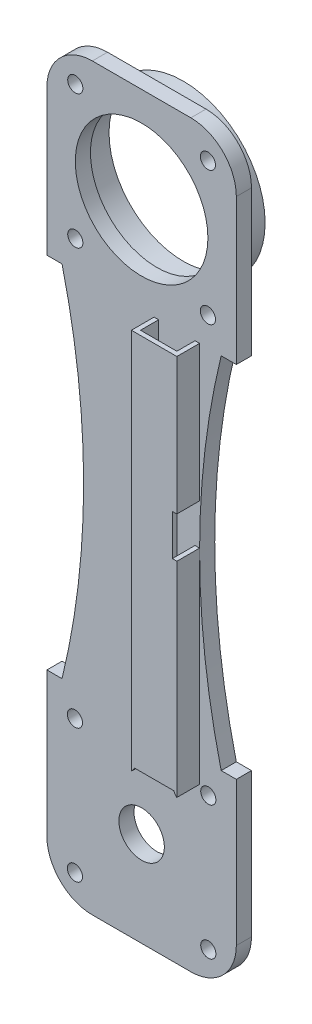
from build123d import *

# Parameters (mm, degrees)
SKETCH1_R           = 11.1125
SKETCH1_R_2         = 1.27
BOSS_EXTRUDE1_DEPTH = 2.54
SKETCH2_R           = 1.27
SKETCH2_R_2         = 3.81
CUT_EXTRUDE1_DEPTH  = 2.54
SKETCH3_R           = 13.716
SKETCH3_R_2         = 12.446
BOSS_EXTRUDE2_DEPTH = 4.445
SKETCH4_W           = 7.62
SKETCH4_H           = 64.008
SKETCH4_W_2         = 6.096
SKETCH4_H_2         = 62.484
EXTRUDE_THIN1_DEPTH = 3.81
SKETCH5_W           = 6.096
SKETCH5_H           = 3.81
CUT_EXTRUDE2_DEPTH  = 76.2
SKETCH6_W           = 7.62
SKETCH6_H           = 64.008
BOSS_EXTRUDE3_DEPTH = 0.762
FILLET1_R           = 2.54
SKETCH7_W           = 3.81
SKETCH7_H           = 6.858
CUT_EXTRUDE3_DEPTH  = 0.762


with BuildPart() as part:
    # Sketch1 → Boss-Extrude1 (new body)
    with BuildSketch(Plane.XY):
        with BuildLine():
            Line((-13.335, -76.2), (-15.875, -76.2))
            Line((-15.875, -76.2), (-15.875, -100.33))
            ThreePointArc((-15.875, -100.33), (-13.643153673, -105.718153673), (-8.255, -107.95))
            Line((-8.255, -107.95), (8.255, -107.95))
            ThreePointArc((8.255, -107.95), (13.643153673, -105.718153673), (15.875, -100.33))
            Line((15.875, -100.33), (15.875, -76.2))
            Line((15.875, -76.2), (13.335, -76.2))
            ThreePointArc((13.335, -76.2), (9.716725547, -46.101), (13.335, -16.002))
            Line((13.335, -16.002), (15.875, -16.002))
            Line((15.875, -16.002), (15.875, 8.382))
            ThreePointArc((15.875, 8.382), (13.643153673, 13.770153673), (8.255, 16.002))
            Line((8.255, 16.002), (-8.255, 16.002))
            ThreePointArc((-8.255, 16.002), (-13.643153673, 13.770153673), (-15.875, 8.382))
            Line((-15.875, 8.382), (-15.875, -16.002))
            Line((-15.875, -16.002), (-13.335, -16.002))
            ThreePointArc((-13.335, -16.002), (-9.716725547, -46.101), (-13.335, -76.2))
        make_face()
        Circle(SKETCH1_R, mode=Mode.SUBTRACT)
        with Locations((11.1125, 11.2014)):
            Circle(SKETCH1_R_2, mode=Mode.SUBTRACT)
        with Locations((11.1125, -11.2014)):
            Circle(SKETCH1_R_2, mode=Mode.SUBTRACT)
        with Locations((-11.1125, -11.2014)):
            Circle(SKETCH1_R_2, mode=Mode.SUBTRACT)
        with Locations((-11.1125, 11.2014)):
            Circle(SKETCH1_R_2, mode=Mode.SUBTRACT)
    extrude(amount=BOSS_EXTRUDE1_DEPTH)

    # Sketch2 → Cut-Extrude1 (cut)
    with BuildSketch(Plane(origin=(0, 0, 0), x_dir=(-1, 0, 0), z_dir=(0, 0, -1))):
        with Locations((-11.176, -80.899)):
            Circle(SKETCH2_R)
        with Locations((11.176, -80.899)):
            Circle(SKETCH2_R)
        with Locations((11.176, -103.251)):
            Circle(SKETCH2_R)
        with Locations((-11.176, -103.251)):
            Circle(SKETCH2_R)
        with Locations((0, -92.075)):
            Circle(SKETCH2_R_2)
    extrude(amount=-CUT_EXTRUDE1_DEPTH, mode=Mode.SUBTRACT)

    # Sketch3 → Boss-Extrude2 (add)
    with BuildSketch(Plane(origin=(0, 0, 0), x_dir=(-1, 0, 0), z_dir=(0, 0, -1))):
        with Locations(Location((0, 0, 0), (0, 0, 180))):
            Circle(SKETCH3_R)
        Circle(SKETCH3_R_2, mode=Mode.SUBTRACT)
    extrude(amount=BOSS_EXTRUDE2_DEPTH)

    # Sketch4 → Extrude-Thin1 (add)
    with BuildSketch(Plane.XY.offset(2.54)):
        with Locations((5.906725547, -48.006)):
            Rectangle(SKETCH4_W, SKETCH4_H)
        with Locations((5.906725547, -48.006)):
            Rectangle(SKETCH4_W_2, SKETCH4_H_2, mode=Mode.SUBTRACT)
    extrude(amount=EXTRUDE_THIN1_DEPTH)

    # Sketch5 → Cut-Extrude2 (cut)
    with BuildSketch(Plane.XZ.offset(80.01)):
        with Locations((5.906725547, 4.445)):
            Rectangle(SKETCH5_W, SKETCH5_H)
    extrude(amount=-CUT_EXTRUDE2_DEPTH, mode=Mode.SUBTRACT)

    # Sketch6 → Boss-Extrude3 (add)
    with BuildSketch(Plane.XY.offset(6.35)):
        with Locations((5.906725547, -48.006)):
            Rectangle(SKETCH6_W, SKETCH6_H)
    extrude(amount=-BOSS_EXTRUDE3_DEPTH)

    # Fillet1
    # the kernel refuses this fillet: 2.54 mm, written as the material it takes off along each edge
    with BuildSketch(Plane(origin=(8.954725547, -80.01, 5.588), x_dir=(0, 1, 0), z_dir=(0, 0, -1)), Plane(origin=(2.858725547, -80.01, 2.54), x_dir=(0, 1, 0), z_dir=(0, 0, 1))) as fillet1_piece_1:
        with BuildLine():
            CenterArc((1.813922821, 2.54), FILLET1_R, 224.427004001, 45.572995999)
            Line((0, 0.762), (0, 0))
            Line((0, 0), (1.813922821, 0))
        make_face()
    extrude(amount=3.048, mode=Mode.SUBTRACT)
    with BuildSketch(Plane(origin=(8.954725547, -80.01, 5.588), x_dir=(0, 1, 0), z_dir=(-1, 0, 0))) as fillet1_piece_2:
        with BuildLine():
            CenterArc((FILLET1_R, -FILLET1_R), FILLET1_R, 90, 90)
            Line((0, -FILLET1_R), (0, 0))
            Line((0, 0), (FILLET1_R, 0))
        make_face()
    extrude(amount=6.096, mode=Mode.SUBTRACT)
    with BuildSketch(Plane(origin=(15.304725547, -80.01, 5.588), x_dir=(0, 1, 0), z_dir=(-1, 0, 0))) as fillet1_piece_3a_section:
        with BuildLine():
            CenterArc((FILLET1_R, -FILLET1_R), FILLET1_R, 90, 90)
            Line((0, -FILLET1_R), (0, 0))
            Line((0, 0), (FILLET1_R, 0))
        make_face()
    fillet1_piece_3a = extrude(amount=12.446, mode=Mode.PRIVATE)
    fillet1_piece_3a = split(fillet1_piece_3a, bisect_by=Plane(origin=(15.304725547, -80.01, 6.35), z_dir=(0, 0, -1)), keep=Keep.TOP, mode=Mode.PRIVATE)
    fillet1_piece_3a = split(fillet1_piece_3a, bisect_by=Plane(origin=(8.954725547, -80.01, 5.588), z_dir=(1, 0, 0)), keep=Keep.TOP, mode=Mode.PRIVATE)
    fillet1_piece_3a = split(fillet1_piece_3a, bisect_by=Plane(origin=(9.716725547, -80.01, 5.588), z_dir=(-1, 0, 0)), keep=Keep.TOP, mode=Mode.PRIVATE)
    with BuildSketch(Plane(origin=(8.954725547, -80.01, 10.122807052), x_dir=(0, 1, 0), z_dir=(0, 0, -1))) as fillet1_piece_3b_section:
        with BuildLine():
            CenterArc((1.813922821, 2.54), FILLET1_R, 224.427004001, 45.572995999)
            Line((0, 0.762), (0, 0))
            Line((0, 0), (1.813922821, 0))
        make_face()
    fillet1_piece_3b = extrude(amount=7.582807052, mode=Mode.PRIVATE)
    fillet1_piece_3b = split(fillet1_piece_3b, bisect_by=Plane(origin=(8.954725547, -80.01, 6.35), z_dir=(0, 0, -1)), keep=Keep.TOP, mode=Mode.PRIVATE)
    fillet1_piece_3b = split(fillet1_piece_3b, bisect_by=Plane(origin=(8.954725547, -80.01, 5.588), z_dir=(0, 0, 1)), keep=Keep.TOP, mode=Mode.PRIVATE)
    fillet1_piece_3 = fillet1_piece_3a & fillet1_piece_3b
    add(fillet1_piece_3, mode=Mode.SUBTRACT)
    with BuildSketch(Plane(origin=(2.858725547, -80.01, 2.54), x_dir=(0, 1, 0), z_dir=(0, 0, 1))) as fillet1_piece_4a_section:
        with BuildLine():
            CenterArc((1.813922821, 2.54), FILLET1_R, 224.427004001, 45.572995999)
            Line((0, 0.762), (0, 0))
            Line((0, 0), (1.813922821, 0))
        make_face()
    fillet1_piece_4a = extrude(amount=7.582807052, mode=Mode.PRIVATE)
    fillet1_piece_4a = split(fillet1_piece_4a, bisect_by=Plane(origin=(2.858725547, -80.01, 6.35), z_dir=(0, 0, -1)), keep=Keep.TOP, mode=Mode.PRIVATE)
    fillet1_piece_4a = split(fillet1_piece_4a, bisect_by=Plane(origin=(2.858725547, -80.01, 5.588), z_dir=(0, 0, 1)), keep=Keep.TOP, mode=Mode.PRIVATE)
    with BuildSketch(Plane(origin=(8.954725547, -80.01, 5.588), x_dir=(0, 1, 0), z_dir=(-1, 0, 0))) as fillet1_piece_4b_section:
        with BuildLine():
            CenterArc((FILLET1_R, -FILLET1_R), FILLET1_R, 90, 90)
            Line((0, -FILLET1_R), (0, 0))
            Line((0, 0), (FILLET1_R, 0))
        make_face()
    fillet1_piece_4b = extrude(amount=12.446, mode=Mode.PRIVATE)
    fillet1_piece_4b = split(fillet1_piece_4b, bisect_by=Plane(origin=(2.096725547, -80.01, 5.588), z_dir=(1, 0, 0)), keep=Keep.TOP, mode=Mode.PRIVATE)
    fillet1_piece_4b = split(fillet1_piece_4b, bisect_by=Plane(origin=(8.954725547, -80.01, 6.35), z_dir=(0, 0, -1)), keep=Keep.TOP, mode=Mode.PRIVATE)
    fillet1_piece_4b = split(fillet1_piece_4b, bisect_by=Plane(origin=(2.858725547, -80.01, 5.588), z_dir=(-1, 0, 0)), keep=Keep.TOP, mode=Mode.PRIVATE)
    fillet1_piece_4 = fillet1_piece_4a & fillet1_piece_4b
    add(fillet1_piece_4, mode=Mode.SUBTRACT)

    # Sketch7 → Cut-Extrude3 (cut)
    with BuildSketch(Plane(origin=(9.716725547, 0, 0), x_dir=(0, 0, -1), z_dir=(1, 0, 0))):
        with Locations((-4.445, -42.291)):
            Rectangle(SKETCH7_W, SKETCH7_H)
    extrude(amount=-CUT_EXTRUDE3_DEPTH, mode=Mode.SUBTRACT)


solid = part.part
